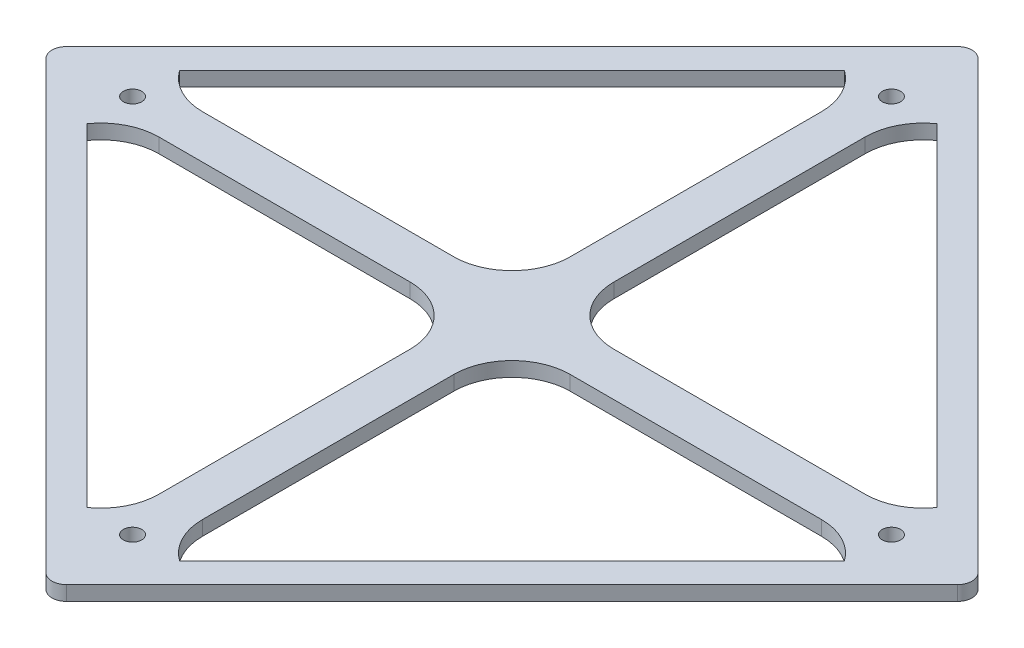
from build123d import *

# Parameters (mm, degrees)
SKETCH1_R           = 2
BOSS_EXTRUDE1_DEPTH = 3.175
CUT_EXTRUDE1_DEPTH  = 144.719172782
FILLET1_R           = 12.7
FILLET2_R           = 3.175


with BuildPart() as part:
    # Sketch1 → Boss-Extrude1 (new body)
    with BuildSketch(Plane(origin=(0, 0, 0), x_dir=(1, 0, 0), z_dir=(0, 1, 0))):
        Polygon((0, -101.6), (-101.6, 0), (0, 101.6), (101.6, 0), align=None)
        with Locations(Location((0, 82.731493173, 0), (0, 0, 270))):
            Circle(SKETCH1_R, mode=Mode.SUBTRACT)
        with Locations(Location((-82.731493173, 0, 0), (0, 0, 270))):
            Circle(SKETCH1_R, mode=Mode.SUBTRACT)
        with Locations(Location((0, -82.731493173, 0), (0, 0, 270))):
            Circle(SKETCH1_R, mode=Mode.SUBTRACT)
        with Locations(Location((82.731493173, 0, 0), (0, 0, 270))):
            Circle(SKETCH1_R, mode=Mode.SUBTRACT)
    extrude(amount=BOSS_EXTRUDE1_DEPTH)

    # Sketch2 → Cut-Extrude1 (cut, through all)
    with BuildSketch(Plane(origin=(0, 3.175, 0), x_dir=(1, 0, 0), z_dir=(0, 1, 0))):
        Polygon((-4.7625, -4.7625), (-82.55, -4.7625), (-82.55, -10.069743879), (-10.069743879, -82.55), (-4.7625, -82.55), align=None)
        Polygon((-4.7625, 4.7625), (-4.7625, 82.55), (-10.069743879, 82.55), (-82.55, 10.069743879), (-82.55, 4.7625), align=None)
        Polygon((4.7625, 82.55), (4.7625, 4.7625), (82.55, 4.7625), (82.55, 10.069743879), (10.069743879, 82.55), align=None)
        Polygon((4.7625, -4.7625), (4.7625, -82.55), (10.069743879, -82.55), (82.55, -10.069743879), (82.55, -4.7625), align=None)
    extrude(amount=-CUT_EXTRUDE1_DEPTH, mode=Mode.SUBTRACT)

    # Fillet1
    # the kernel refuses this fillet: 12.7 mm, written as the material it adds along each edge
    with BuildSketch(Plane(origin=(4.7625, 3.175, 82.55), x_dir=(0, 0, -1), z_dir=(0, -1, 0)), Plane(origin=(-82.55, 3.175, 4.7625), x_dir=(1, 0, 0), z_dir=(0, -1, 0)), Plane(origin=(-4.7625, 3.175, -82.55), x_dir=(0, 0, 1), z_dir=(0, -1, 0))) as fillet1_piece_1:
        with BuildLine():
            CenterArc((10.326526857, 12.7), FILLET1_R, 215.59885924, 54.40114076)
            Line((0, 5.307243879), (-0.206530537, 5.159388757))
            ThreePointArc((-0.206530537, 5.159388757), (-0.254, 2.653621939), (-0.254, 0))
            Line((-0.254, 0), (0, -0.254))
            Line((0, -0.254), (10.326526857, -0.254))
            Line((10.326526857, -0.254), (10.326526857, 0))
        make_face()
    extrude(amount=3.175)
    with BuildSketch(Plane(origin=(4.7625, 3.175, 4.7625), x_dir=(0, 0, 1), z_dir=(0, -1, 0)), Plane(origin=(-4.7625, 3.175, -4.7625), x_dir=(0, 0, -1), z_dir=(0, -1, 0)), Plane(origin=(-4.7625, 3.175, 4.7625), x_dir=(-1, 0, 0), z_dir=(0, -1, 0))) as fillet1_piece_2:
        with BuildLine():
            CenterArc((FILLET1_R, -FILLET1_R), FILLET1_R, 90, 90)
            Line((0, -FILLET1_R), (-FILLET1_R * 0.02, -FILLET1_R))
            Line((-FILLET1_R * 0.02, -FILLET1_R), (-FILLET1_R * 0.02, FILLET1_R * 0.02))
            Line((-FILLET1_R * 0.02, FILLET1_R * 0.02), (FILLET1_R, FILLET1_R * 0.02))
            Line((FILLET1_R, FILLET1_R * 0.02), (FILLET1_R, 0))
        make_face()
    extrude(amount=3.175)
    with BuildSketch(Plane(origin=(82.55, 3.175, 4.7625), x_dir=(-1, 0, 0), z_dir=(0, -1, 0)), Plane(origin=(-4.7625, 3.175, 82.55), x_dir=(0, 0, -1), z_dir=(0, -1, 0)), Plane(origin=(-82.55, 3.175, -4.7625), x_dir=(1, 0, 0), z_dir=(0, -1, 0)), Plane(origin=(4.7625, 3.175, -82.55), x_dir=(0, 0, 1), z_dir=(0, -1, 0))) as fillet1_piece_3:
        with BuildLine():
            CenterArc((10.326526857, -12.7), FILLET1_R, 90, 54.40114076)
            Line((0, -5.307243879), (-0.206530537, -5.159388757))
            ThreePointArc((-0.206530537, -5.159388757), (-0.254, -2.653621939), (-0.254, 0))
            Line((-0.254, 0), (0, 0.254))
            Line((0, 0.254), (10.326526857, 0.254))
            Line((10.326526857, 0.254), (10.326526857, 0))
        make_face()
    extrude(amount=3.175)
    with BuildSketch(Plane(origin=(82.55, 3.175, -4.7625), x_dir=(0, 0, -1), z_dir=(0, -1, 0))) as fillet1_piece_4:
        with BuildLine():
            CenterArc((12.7, -10.326526857), FILLET1_R, 125.59885924, 54.40114076)
            Line((0, -10.326526857), (-0.254, -10.326526857))
            Line((-0.254, -10.326526857), (-0.254, 0))
            Line((-0.254, 0), (0, 0.254))
            ThreePointArc((0, 0.254), (2.653621939, 0.254), (5.159388757, 0.206530537))
            Line((5.159388757, 0.206530537), (5.307243879, 0))
        make_face()
    extrude(amount=3.175)
    with BuildSketch(Plane(origin=(4.7625, 3.175, -4.7625), x_dir=(0, 0, -1), z_dir=(0, -1, 0))) as fillet1_piece_5:
        with BuildLine():
            CenterArc((FILLET1_R, FILLET1_R), FILLET1_R, 180, 90)
            Line((0, FILLET1_R), (-FILLET1_R * 0.02, FILLET1_R))
            Line((-FILLET1_R * 0.02, FILLET1_R), (-FILLET1_R * 0.02, -FILLET1_R * 0.02))
            Line((-FILLET1_R * 0.02, -FILLET1_R * 0.02), (FILLET1_R, -FILLET1_R * 0.02))
            Line((FILLET1_R, -FILLET1_R * 0.02), (FILLET1_R, 0))
        make_face()
    extrude(amount=3.175)

    # Fillet2
    fillet2_edges = [part.edges().sort_by_distance(p)[0] for p in [
        (0, 1.5875, 101.6),
        (-101.6, 1.5875, 0),
        (0, 1.5875, -101.6),
        (101.6, 1.5875, 0),
    ]]
    fillet(fillet2_edges, radius=FILLET2_R)


solid = part.part
